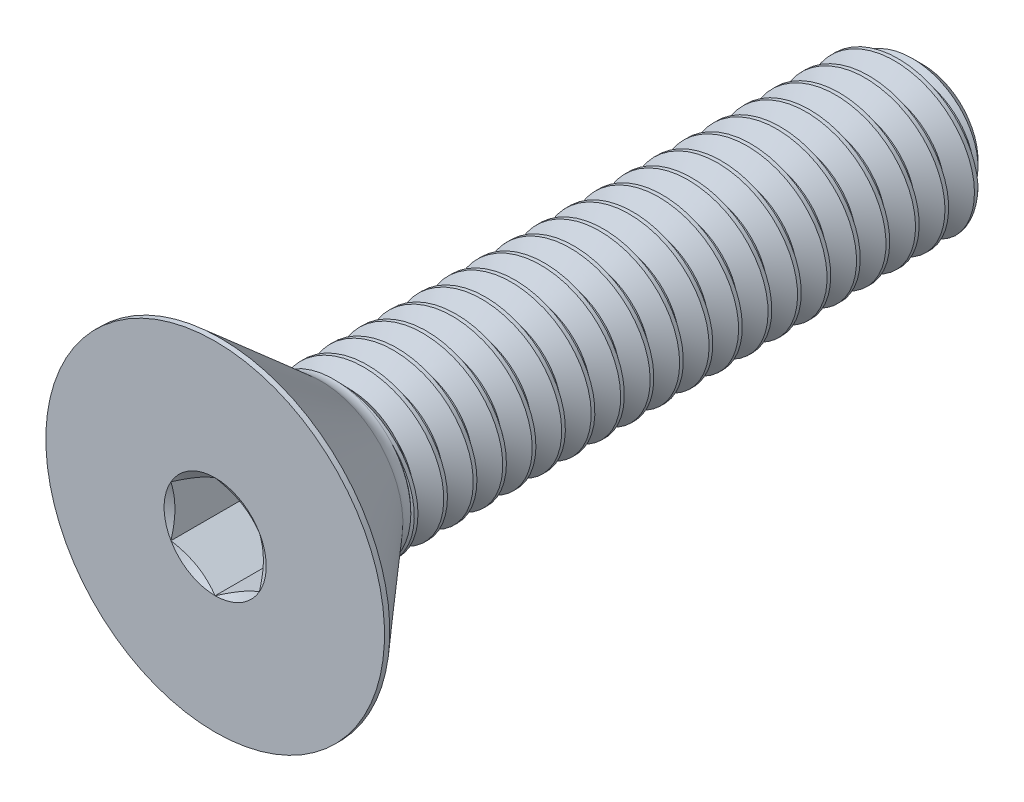
from build123d import *

# Parameters (mm, degrees)
SKETCH1_W          = 19.05
SKETCH1_H          = 2.0828
CHAMFER1_SIZE      = 0.5953125
CUT_SWEEP1_PITCH   = 0.79375
CUT_EXTRUDE2_DEPTH = 1.99136


with BuildPart() as part:
    # Sketch1 → Revolve1 (revolve)
    with BuildSketch(Plane(origin=(0, 0, 0), x_dir=(0, 0, -1), z_dir=(1, 0, 0))):
        with Locations((9.525, 1.0414)):
            Rectangle(SKETCH1_W, SKETCH1_H)
    revolve(axis=Axis((0, 0, -19.05), (0, 0, 1)))

    # Chamfer1
    chamfer1_edges = [part.edges().sort_by_distance(p)[0] for p in [
        (0, -2.0828, -19.05),
    ]]
    chamfer(chamfer1_edges, length=CHAMFER1_SIZE)

    # Cut-Sweep1: arcs per turn and ends read off the stored shape
    # Cut-Sweep1: the profile of Sketch2 profile screwed along a right-hand helix through 25 turns, 8 arcs to a turn; built about Z, then put on its axis
    cut_sweep1_z = Axis((0, 0, 0), (0, 0, 1))
    cut_sweep1_corners = [(2.0831, 0, 0.000173205), (2.0831, 0, -0.694704455), (1.567244252, 0, -0.396875), (1.567244252, 0, -0.29765625)]
    with BuildLine(mode=Mode.PRIVATE) as cut_sweep1_profile:
        Line(cut_sweep1_corners[0], cut_sweep1_corners[1])
        Line(cut_sweep1_corners[1], cut_sweep1_corners[2])
        Line(cut_sweep1_corners[2], cut_sweep1_corners[3])
        Line(cut_sweep1_corners[3], cut_sweep1_corners[0])
    cut_sweep1_cap = Face(cut_sweep1_profile.wire())
    cut_sweep1_turn_angles = [0, 22.5, 45, 67.5, 90, 112.5, 135, 157.5, 180, 202.5, 225, 247.5, 270, 292.5, 315, 337.5, 360]
    cut_sweep1_turn_weights = [1, 0.9238795325112867, 1, 0.9238795325112867, 1, 0.9238795325112867, 1, 0.9238795325112867, 1, 0.9238795325112867, 1, 0.9238795325112867, 1, 0.9238795325112867, 1, 0.9238795325112867, 1]
    cut_sweep1_turn_rails = [Edge.make_bspline([Vector(p[0], p[1], 0).rotate(cut_sweep1_z, cut_sweep1_turn_angles[k]) / cut_sweep1_turn_weights[k] + Vector(0, 0, p[2] + CUT_SWEEP1_PITCH * cut_sweep1_turn_angles[k] / 360) for k in range(17)], [0, 0, 0, 1, 1, 2, 2, 3, 3, 4, 4, 5, 5, 6, 6, 7, 7, 8, 8, 8], 2, cut_sweep1_turn_weights) for p in cut_sweep1_corners]
    cut_sweep1_turn_sides = [Face.make_surface_from_curves(cut_sweep1_turn_rails[p[0]], cut_sweep1_turn_rails[p[1]]) for p in [(0, 1), (1, 2), (2, 3), (3, 0)]]
    cut_sweep1 = Plane(origin=(0, 0, -19.05), x_dir=(0, 1, 0), z_dir=(0, 0, 1)) * Solid(Shell([*[p.moved(Location((0, 0, CUT_SWEEP1_PITCH * i))) for i in range(25) for p in cut_sweep1_turn_sides], cut_sweep1_cap, cut_sweep1_cap.rotate(cut_sweep1_z, 9000).moved(Location((0, 0, CUT_SWEEP1_PITCH * 9000 / 360)))]))
    add(cut_sweep1, mode=Mode.SUBTRACT)

    # Sketch7 → Revolve2 (revolve)
    with BuildSketch(Plane(origin=(0, 0, 0), x_dir=(0, 0, -1), z_dir=(1, 0, 0)), mode=Mode.PRIVATE) as revolve2_sk:
        with BuildLine():
            Line((0, 4.5593), (0.14224, 4.5593))
            Line((0.14224, 4.5593), (2.8448, 2.210000434))
            ThreePointArc((2.8448, 2.210000434), (3.003405714, 2.11563995), (3.185013014, 2.0828))
            Line((3.185013014, 2.0828), (3.185013014, 0))
            Line((3.185013014, 0), (0, 0))
            Line((0, 0), (0, 4.5593))
        make_face()
    revolve(revolve2_sk.sketch.rotate(Axis((0, 0, 0), (0, 0, -1)), 189.052465709), axis=Axis((0, 0, 0), (0, 0, -1)))

    # Boss-Extrude1 cone 1 section (through the dimple's axis) → Boss-Extrude1 (revolve)
    with BuildSketch(Plane(origin=(0, 0, -3.185013014), x_dir=(0, -1, 0), z_dir=(1, 0, 0))):
        Polygon((0, 0), (2.0828, 0), (0, 2.01133658), align=None)
    revolve(axis=Axis((0, 0, -3.185013014), (0, 0, -1)))

    # Sketch5 → Cut-Extrude2 (cut)
    with BuildSketch(Plane.XY):
        Polygon((0, 1.374815329), (-1.190625, 0.687407664), (-1.190625, -0.687407664), (0, -1.374815329), (1.190625, -0.687407664), (1.190625, 0.687407664), align=None)
    extrude(amount=-CUT_EXTRUDE2_DEPTH, mode=Mode.SUBTRACT)

    # Cut-Extrude3 cone 1 section (through the dimple's axis) → Cut-Extrude3 (revolve, cut)
    with BuildSketch(Plane(origin=(0, 0, 0), x_dir=(0, -1, 0), z_dir=(1, 0, 0))):
        Polygon((0, 0), (1.374815329, 0), (0, 0.79375), align=None)
    revolve(axis=Axis((0, 0, 0), (0, 0, -1)), mode=Mode.SUBTRACT)


solid = part.part
